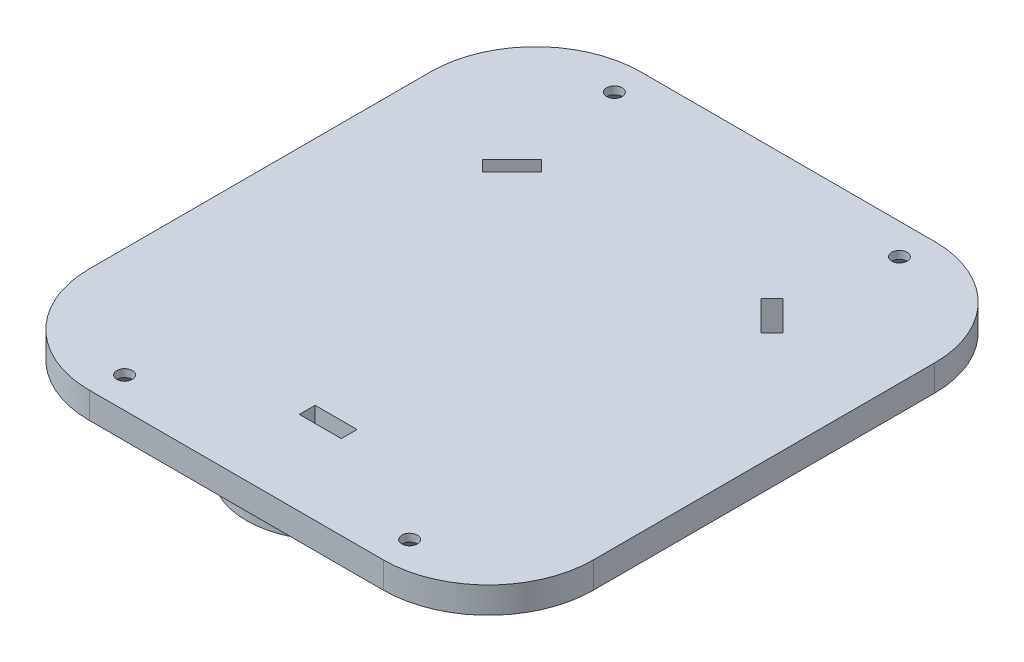
from build123d import *

# Parameters (mm, degrees)
BASE_DEPTH         = 5
SKETCH3_R          = 1.85
PLATFORMS_DEPTH    = 3.5
SKETCH4_W          = 8
SKETCH4_H          = 3
TENDON_HOLES_DEPTH = 8.5
GROOVES_DEPTH      = 1.82
FILLET1_R          = 0.5


# Read off the part's stored shape, not the designer's step: CSK for #4 Flat Head Socket Cap Screw1
with BuildPart() as part:
    # Sketch2 → base (new body)
    # profile 1 of 4: a face of its own
    with BuildSketch(Plane.XZ.offset(46.378198451)):
        with BuildLine():
            ThreePointArc((22.485654363, 45.643380576), (16.627789987, 59.7855162), (2.485654363, 65.643380576))
            Line((2.485654363, 65.643380576), (-53.514345637, 65.643380576))
            ThreePointArc((-53.514345637, 65.643380576), (-67.656481261, 59.7855162), (-73.514345637, 45.643380576))
            Line((-73.514345637, 45.643380576), (-73.514345637, -19.356619424))
            ThreePointArc((-73.514345637, -19.356619424), (-67.656481261, -33.498755048), (-53.514345637, -39.356619424))
            Line((-53.514345637, -39.356619424), (2.485654363, -39.356619424))
            ThreePointArc((2.485654363, -39.356619424), (16.627789987, -33.498755048), (22.485654363, -19.356619424))
            Line((22.485654363, -19.356619424), (22.485654363, 45.643380576))
        make_face()
        with BuildLine():
            Line((-18.47542484, 44.963380576), (-27.514345637, 44.963380576))
            Line((-27.514345637, 44.963380576), (-27.514345637, 51.313380576))
            Line((-27.514345637, 51.313380576), (-12.12542484, 51.313380576))
            Line((-12.12542484, 51.313380576), (-12.12542484, 18.143380576))
            Line((-12.12542484, 18.143380576), (-8.98470499, 18.143380576))
            ThreePointArc((-8.98470499, 18.143380576), (-2.95042484, 17.143380576), (-8.98470499, 16.143380576))
            Line((-8.98470499, 16.143380576), (-21.61614469, 16.143380576))
            ThreePointArc((-21.61614469, 16.143380576), (-27.65042484, 17.143380576), (-21.61614469, 18.143380576))
            Line((-21.61614469, 18.143380576), (-18.47542484, 18.143380576))
            Line((-18.47542484, 18.143380576), (-18.47542484, 44.963380576))
        make_face(mode=Mode.SUBTRACT)
        with BuildLine():
            Line((-32.582913534, -14.780356765), (-52.263082978, -14.780356765))
            Line((-52.263082978, -14.780356765), (-52.263082978, -8.430356765))
            Line((-52.263082978, -8.430356765), (-38.932913534, -8.430356765))
            Line((-38.932913534, -8.430356765), (-38.932913534, 7.143380576))
            Line((-38.932913534, 7.143380576), (-42.073633384, 7.143380576))
            ThreePointArc((-42.073633384, 7.143380576), (-48.107913534, 8.143380576), (-42.073633384, 9.143380576))
            Line((-42.073633384, 9.143380576), (-29.442193685, 9.143380576))
            ThreePointArc((-29.442193685, 9.143380576), (-23.407913534, 8.143380576), (-29.442193685, 7.143380576))
            Line((-29.442193685, 7.143380576), (-32.582913534, 7.143380576))
            Line((-32.582913534, 7.143380576), (-32.582913534, -14.780356765))
        make_face(mode=Mode.SUBTRACT)
        with BuildLine():
            Line((9.066452763, 7.143380576), (9.066452763, -14.780356765))
            Line((9.066452763, -14.780356765), (-2.765608295, -14.780356765))
            Line((-2.765608295, -14.780356765), (-2.765608295, -8.430356765))
            Line((-2.765608295, -8.430356765), (2.716452763, -8.430356765))
            Line((2.716452763, -8.430356765), (2.716452763, 7.143380576))
            Line((2.716452763, 7.143380576), (-0.432014427, 7.143380576))
            ThreePointArc((-0.432014427, 7.143380576), (-6.466294577, 8.143380576), (-0.432014427, 9.143380576))
            Line((-0.432014427, 9.143380576), (12.199425273, 9.143380576))
            ThreePointArc((12.199425273, 9.143380576), (18.233705423, 8.143380576), (12.199425273, 7.143380576))
            Line((12.199425273, 7.143380576), (9.066452763, 7.143380576))
        make_face(mode=Mode.SUBTRACT)
    # profile 2 of 4: a face of its own
    with BuildSketch(Plane.XZ.offset(46.378198451)):
        with BuildLine():
            Line((-27.514345637, 44.963380576), (-27.514345637, 51.313380576))
            Line((-27.514345637, 51.313380576), (-12.12542484, 51.313380576))
            Line((-12.12542484, 51.313380576), (-12.12542484, 18.143380576))
            Line((-12.12542484, 18.143380576), (-8.98470499, 18.143380576))
            ThreePointArc((-8.98470499, 18.143380576), (-2.95042484, 17.143380576), (-8.98470499, 16.143380576))
            Line((-8.98470499, 16.143380576), (-21.61614469, 16.143380576))
            ThreePointArc((-21.61614469, 16.143380576), (-27.65042484, 17.143380576), (-21.61614469, 18.143380576))
            Line((-21.61614469, 18.143380576), (-18.47542484, 18.143380576))
            Line((-18.47542484, 18.143380576), (-18.47542484, 44.963380576))
            Line((-18.47542484, 44.963380576), (-27.514345637, 44.963380576))
        make_face()
    # profile 3 of 4: a face of its own
    with BuildSketch(Plane.XZ.offset(46.378198451)):
        with BuildLine():
            Line((9.066452763, -14.780356765), (-2.765608295, -14.780356765))
            Line((-2.765608295, -14.780356765), (-2.765608295, -8.430356765))
            Line((-2.765608295, -8.430356765), (2.716452763, -8.430356765))
            Line((2.716452763, -8.430356765), (2.716452763, 7.143380576))
            Line((2.716452763, 7.143380576), (-0.432014427, 7.143380576))
            ThreePointArc((-0.432014427, 7.143380576), (-6.466294577, 8.143380576), (-0.432014427, 9.143380576))
            Line((-0.432014427, 9.143380576), (12.199425273, 9.143380576))
            ThreePointArc((12.199425273, 9.143380576), (18.233705423, 8.143380576), (12.199425273, 7.143380576))
            Line((12.199425273, 7.143380576), (9.066452763, 7.143380576))
            Line((9.066452763, 7.143380576), (9.066452763, -14.780356765))
        make_face()
    # profile 4 of 4: a face of its own
    with BuildSketch(Plane.XZ.offset(46.378198451)):
        with BuildLine():
            Line((-52.263082978, -14.780356765), (-52.263082978, -8.430356765))
            Line((-52.263082978, -8.430356765), (-38.932913534, -8.430356765))
            Line((-38.932913534, -8.430356765), (-38.932913534, 7.143380576))
            Line((-38.932913534, 7.143380576), (-42.073633384, 7.143380576))
            ThreePointArc((-42.073633384, 7.143380576), (-48.107913534, 8.143380576), (-42.073633384, 9.143380576))
            Line((-42.073633384, 9.143380576), (-29.442193685, 9.143380576))
            ThreePointArc((-29.442193685, 9.143380576), (-23.407913534, 8.143380576), (-29.442193685, 7.143380576))
            Line((-29.442193685, 7.143380576), (-32.582913534, 7.143380576))
            Line((-32.582913534, 7.143380576), (-32.582913534, -14.780356765))
            Line((-32.582913534, -14.780356765), (-52.263082978, -14.780356765))
        make_face()
    extrude(amount=BASE_DEPTH)

    # Sketch3 → platforms (add)
    # profile 1 of 3: a face of its own
    with BuildSketch(Plane.XZ.offset(51.378198451)):
        with BuildLine():
            Line((-12.814345637, 39.143380576), (-12.814345637, 57.143380576))
            ThreePointArc((-12.814345637, 57.143380576), (-25.514345637, 63.709047925), (-38.214345637, 57.143380576))
            Line((-38.214345637, 57.143380576), (-38.214345637, 39.143380576))
            ThreePointArc((-38.214345637, 39.143380576), (-25.514345637, 32.577713228), (-12.814345637, 39.143380576))
        make_face()
        with Locations(Location((-25.514345637, 37.143380576, 0), (0, 0, 270))):
            Circle(SKETCH3_R, mode=Mode.SUBTRACT)
        with Locations(Location((-25.514345637, 59.143380576, 0), (0, 0, 270))):
            Circle(SKETCH3_R, mode=Mode.SUBTRACT)
    # profile 2 of 3: a face of its own
    with BuildSketch(Plane.XZ.offset(51.378198451)):
        with BuildLine():
            Line((-47.646787888, -26.949573917), (-34.918865827, -14.221651856))
            ThreePointArc((-34.918865827, -14.221651856), (-39.256494043, -0.59876783), (-52.879378069, 3.738860386))
            Line((-52.879378069, 3.738860386), (-65.60730013, -8.989061675))
            ThreePointArc((-65.60730013, -8.989061675), (-61.269671914, -22.611945701), (-47.646787888, -26.949573917))
        make_face()
        with Locations(Location((-42.484908385, -3.827182172, 0), (0, 0, 270))):
            Circle(SKETCH3_R, mode=Mode.SUBTRACT)
        with Locations(Location((-58.041257571, -19.383531358, 0), (0, 0, 270))):
            Circle(SKETCH3_R, mode=Mode.SUBTRACT)
        Polygon((-48.495316025, -15.494444062), (-54.152170275, -9.837589812), (-52.030849931, -7.716269469), (-46.373995682, -13.373123718), align=None, mode=Mode.SUBTRACT)
    # profile 3 of 3: a face of its own
    with BuildSketch(Plane.XZ.offset(51.378198451)):
        with BuildLine():
            Line((14.578608856, -8.989061675), (1.850686795, 3.738860386))
            ThreePointArc((1.850686795, 3.738860386), (-11.772197231, -0.59876783), (-16.109825447, -14.221651856))
            Line((-16.109825447, -14.221651856), (-3.381903386, -26.949573917))
            ThreePointArc((-3.381903386, -26.949573917), (10.24098064, -22.611945701), (14.578608856, -8.989061675))
        make_face()
        with Locations(Location((7.012566298, -19.383531358, 0), (0, 0, 270))):
            Circle(SKETCH3_R, mode=Mode.SUBTRACT)
        with Locations(Location((-8.543782888, -3.827182172, 0), (0, 0, 270))):
            Circle(SKETCH3_R, mode=Mode.SUBTRACT)
        Polygon((1.002158658, -7.716269469), (-4.654695592, -13.373123718), (-2.533375248, -15.494444062), (3.123479001, -9.837589812), align=None, mode=Mode.SUBTRACT)
    extrude(amount=PLATFORMS_DEPTH)

    # Sketch4 → tendon holes (cut)
    with BuildSketch(Plane.XZ.offset(54.878198451)):
        with Locations((-25.514345637, 48.143380576)):
            Rectangle(SKETCH4_W, SKETCH4_H)
        Polygon((-4.654695592, -13.373123718), (1.002158658, -7.716269469), (3.123479001, -9.837589812), (-2.533375248, -15.494444062), align=None)
        Polygon((-46.373995682, -13.373123718), (-48.495316025, -15.494444062), (-54.152170275, -9.837589812), (-52.030849931, -7.716269469), align=None)
    extrude(amount=-TENDON_HOLES_DEPTH, mode=Mode.SUBTRACT)

    # Sketch6 → grooves (add)
    with BuildSketch(Plane.XZ.offset(54.878198451)):
        with BuildLine():
            Line((-20.001012304, 59.234273742), (-20.001012304, 37.05248741))
            ThreePointArc((-20.001012304, 37.05248741), (-17.832606126, 38.427639032), (-15.994345637, 40.220353651))
            Line((-15.994345637, 40.220353651), (-15.994345637, 56.066407502))
            ThreePointArc((-15.994345637, 56.066407502), (-17.832606126, 57.859122121), (-20.001012304, 59.234273742))
        make_face()
        with BuildLine():
            Line((-35.034345637, 56.066407502), (-35.034345637, 40.220353651))
            ThreePointArc((-35.034345637, 40.220353651), (-33.196085147, 38.427639032), (-31.02767897, 37.05248741))
            Line((-31.02767897, 37.05248741), (-31.02767897, 59.234273742))
            ThreePointArc((-31.02767897, 59.234273742), (-33.196085147, 57.859122121), (-35.034345637, 56.066407502))
        make_face()
        with BuildLine():
            Line((-62.004044132, -15.549287145), (-46.319152598, 0.135604389))
            ThreePointArc((-46.319152598, 0.135604389), (-48.824826347, 0.696520064), (-51.392313469, 0.728725858))
            Line((-51.392313469, 0.728725858), (-62.597165602, -10.476126275))
            ThreePointArc((-62.597165602, -10.476126275), (-62.564959808, -13.043613396), (-62.004044132, -15.549287145))
        make_face()
        with BuildLine():
            Line((-38.522121824, -7.661426385), (-54.207013359, -23.346317919))
            ThreePointArc((-54.207013359, -23.346317919), (-51.701339609, -23.907233595), (-49.133852488, -23.939439389))
            Line((-49.133852488, -23.939439389), (-37.929000355, -12.734587256))
            ThreePointArc((-37.929000355, -12.734587256), (-37.961206149, -10.167100134), (-38.522121824, -7.661426385))
        make_face()
        with BuildLine():
            Line((-13.099690919, -12.734587256), (-1.894838786, -23.939439389))
            ThreePointArc((-1.894838786, -23.939439389), (0.672648336, -23.907233595), (3.178322085, -23.346317919))
            Line((3.178322085, -23.346317919), (-12.506569449, -7.661426385))
            ThreePointArc((-12.506569449, -7.661426385), (-13.067485125, -10.167100134), (-13.099690919, -12.734587256))
        make_face()
        with BuildLine():
            Line((11.568474328, -10.476126275), (0.363622195, 0.728725858))
            ThreePointArc((0.363622195, 0.728725858), (-2.203864926, 0.696520064), (-4.709538675, 0.135604389))
            Line((-4.709538675, 0.135604389), (10.975352859, -15.549287145))
            ThreePointArc((10.975352859, -15.549287145), (11.536268534, -13.043613396), (11.568474328, -10.476126275))
        make_face()
    extrude(amount=GROOVES_DEPTH)

    # Fillet1
    fillet1_edges = [part.edges().sort_by_distance(p)[0] for p in [
        (-17.832606126, -56.698198451, 57.859122121),
        (-20.001012304, -56.698198451, 48.143380576),
        (-17.832606126, -56.698198451, 38.427639032),
        (-15.994345637, -56.698198451, 48.143380576),
        (-33.196085147, -56.698198451, 57.859122121),
        (-35.034345637, -56.698198451, 48.143380576),
        (-33.196085147, -56.698198451, 38.427639032),
        (-31.02767897, -56.698198451, 48.143380576),
        (-62.564959808, -56.698198451, -13.043613396),
        (-54.161598365, -56.698198451, -7.706841378),
        (-48.824826347, -56.698198451, 0.696520064),
        (-56.994739535, -56.698198451, -4.873700208),
        (-37.961206149, -56.698198451, -10.167100134),
        (-46.364567591, -56.698198451, -15.503872152),
        (-51.701339609, -56.698198451, -23.907233595),
        (-43.531426421, -56.698198451, -18.337013322),
        (-13.067485125, -56.698198451, -10.167100134),
        (-7.497264852, -56.698198451, -18.337013322),
        (0.672648336, -56.698198451, -23.907233595),
        (-4.664123682, -56.698198451, -15.503872152),
        (11.536268534, -56.698198451, -13.043613396),
        (5.966048262, -56.698198451, -4.873700208),
        (-2.203864926, -56.698198451, 0.696520064),
        (3.132907092, -56.698198451, -7.706841378),
    ]]
    fillet(fillet1_edges, radius=FILLET1_R)

    # CSK for #4 Flat Head Socket Cap Screw1 o → CSK for #4 Flat Head Socket Cap Screw1 (revolve, cut)
    with BuildSketch(Plane(origin=(1.627789987, 0, 59.7855162), x_dir=(1, 0, 0), z_dir=(0, 0, 1))):
        Polygon((1.4732, -47.847453101), (1.4732, -46.378198451), (0, -46.378198451), (0, -51.378198451), (3.2385, -51.378198451), (3.2385, -49.878198451), align=None)
    revolve(axis=Axis((1.627789987, 0, 59.7855162), (0, 1, 0)), mode=Mode.SUBTRACT)

    # CSK for _4 Flat Head Socket Cap Scre 2 → CSK for _4 Flat Head Socket Cap Screw1 2 (revolve, cut)
    with BuildSketch(Plane(origin=(1.627789987, 0, -33.498755048), x_dir=(1, 0, 0), z_dir=(0, 0, 1))):
        Polygon((1.4732, -47.847453101), (1.4732, -46.378198451), (0, -46.378198451), (0, -51.378198451), (3.2385, -51.378198451), (3.2385, -49.878198451), align=None)
    revolve(axis=Axis((1.627789987, 0, -33.498755048), (0, 1, 0)), mode=Mode.SUBTRACT)

    # CSK for _4 Flat Head Socket Cap Scre 3 → CSK for _4 Flat Head Socket Cap Screw1 3 (revolve, cut)
    with BuildSketch(Plane(origin=(-52.656481261, 0, -33.498755048), x_dir=(1, 0, 0), z_dir=(0, 0, 1))):
        Polygon((1.4732, -47.847453101), (1.4732, -46.378198451), (0, -46.378198451), (0, -51.378198451), (3.2385, -51.378198451), (3.2385, -49.878198451), align=None)
    revolve(axis=Axis((-52.656481261, 0, -33.498755048), (0, 1, 0)), mode=Mode.SUBTRACT)

    # CSK for _4 Flat Head Socket Cap Scre 4 → CSK for _4 Flat Head Socket Cap Screw1 4 (revolve, cut)
    with BuildSketch(Plane(origin=(-52.656481261, 0, 59.7855162), x_dir=(1, 0, 0), z_dir=(0, 0, 1))):
        Polygon((1.4732, -47.847453101), (1.4732, -46.378198451), (0, -46.378198451), (0, -51.378198451), (3.2385, -51.378198451), (3.2385, -49.878198451), align=None)
    revolve(axis=Axis((-52.656481261, 0, 59.7855162), (0, 1, 0)), mode=Mode.SUBTRACT)


solid = part.part
